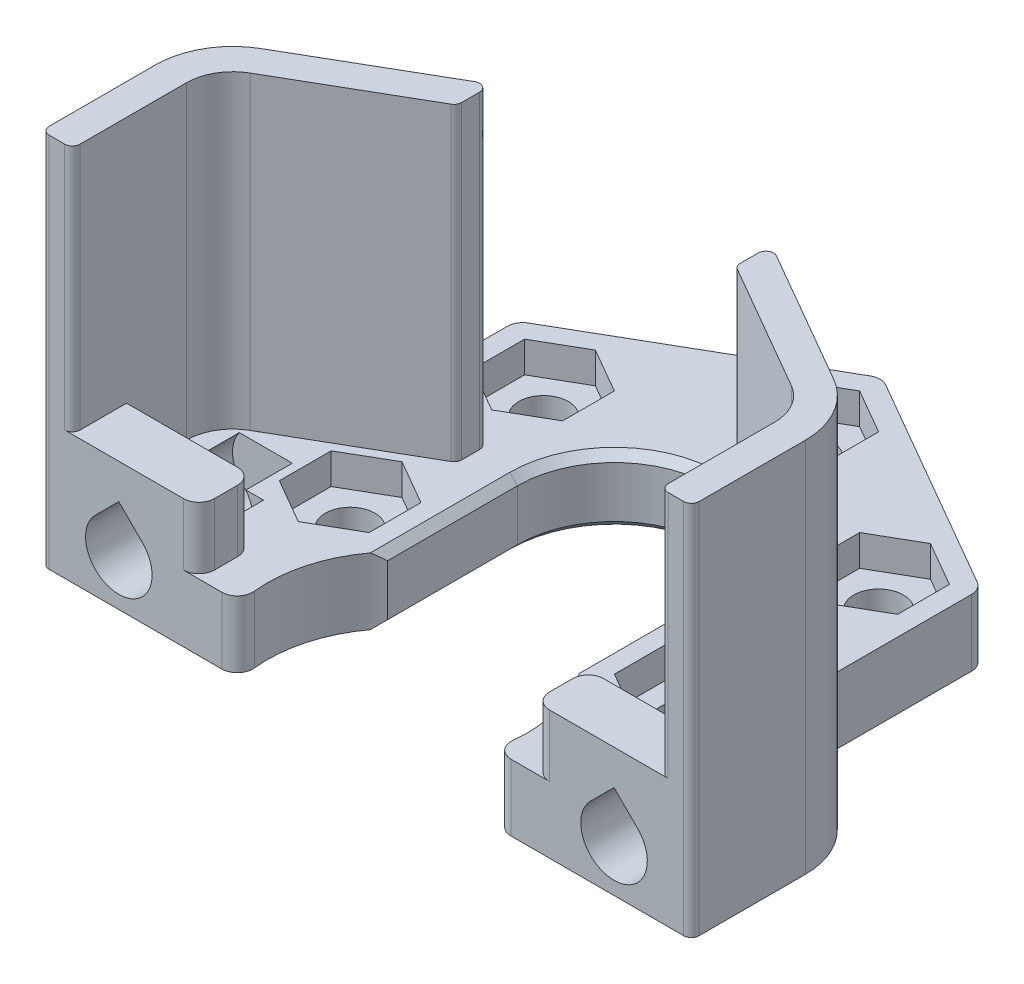
from build123d import *

# Parameters (mm, degrees)
SKETCH1_R                       = 1.6
BOSS_EXTRUDE1_DEPTH             = 4.3
FILLET1_R                       = 1
CUT_EXTRUDE1_DEPTH              = 2
BOSS_EXTRUDE2_DEPTH             = 4.3
SKETCH4_R                       = 8.4
CUT_EXTRUDE2_DEPTH              = 32.552755501
SKETCH5_W                       = 40
SKETCH5_H                       = 8
CUT_EXTRUDE3_DEPTH              = 32.552755501
MOVE_FACE1_DEPTH                = 4.3
BOSS_EXTRUDE3_START             = 4
BOSS_EXTRUDE3_DEPTH             = 4
SKETCH7_R                       = 2.15
CUT_EXTRUDE4_DEPTH              = 3.5
CUT_EXTRUDE5_DEPTH              = 3
SKETCH9_W                       = 21.650635094
SKETCH9_H                       = 3.5
CUT_EXTRUDE6_DEPTH              = 4
FILLET2_R                       = 1
CHAMFER1_SIZE                   = 0.5
CUT_EXTRUDE7_DEPTH              = 3.5
BOSS_EXTRUDE4_REACH             = 28.705
BOSS_EXTRUDE4_DIRECTION_2_DEPTH = 20
FILLET3_R                       = 3
FILLET4_R                       = 5
FILLET5_R                       = 0.5
CUT_EXTRUDE8_DEPTH              = 9.5


# Read off the part's stored shape, not the designer's step: Move Face1
with BuildPart() as part:
    # Sketch1 → Boss-Extrude1 (new body)
    with BuildSketch(Plane(origin=(0, 0, 0), x_dir=(1, 0, 0), z_dir=(0, 1, 0))):
        with BuildLine():
            Line((0, 17.320508076), (-15, 8.660254038))
            Line((-15, 8.660254038), (-15, -8.660254038))
            Line((-15, -8.660254038), (-6.25, -13.712068893))
            Line((-6.25, -13.712068893), (-6.25, 0))
            ThreePointArc((-6.25, 0), (0, 6.25), (6.25, 0))
            Line((6.25, 0), (6.25, -13.712068893))
            Line((6.25, -13.712068893), (15, -8.660254038))
            Line((15, -8.660254038), (15, 8.660254038))
            Line((15, 8.660254038), (0, 17.320508076))
        make_face()
        with Locations(Location((0, 12.5, 0), (0, 0, 90))):
            Circle(SKETCH1_R, mode=Mode.SUBTRACT)
        with Locations(Location((10.825317547, 6.25, 0), (0, 0, 90))):
            Circle(SKETCH1_R, mode=Mode.SUBTRACT)
        with Locations(Location((10.825317547, -6.25, 0), (0, 0, 90))):
            Circle(SKETCH1_R, mode=Mode.SUBTRACT)
        with Locations(Location((-10.825317547, -6.25, 0), (0, 0, 90))):
            Circle(SKETCH1_R, mode=Mode.SUBTRACT)
        with Locations(Location((-10.825317547, 6.25, 0), (0, 0, 90))):
            Circle(SKETCH1_R, mode=Mode.SUBTRACT)
    extrude(amount=BOSS_EXTRUDE1_DEPTH)

    # Fillet1
    fillet1_edges = [part.edges().sort_by_distance(p)[0] for p in [
        (15, 2.15, -8.660254038),
        (15, 2.15, 8.660254038),
        (6.25, 2.15, 13.712068893),
        (-6.25, 2.15, 13.712068893),
        (-15, 2.15, 8.660254038),
        (-15, 2.15, -8.660254038),
        (0, 2.15, -17.320508076),
    ]]
    fillet(fillet1_edges, radius=FILLET1_R)

    # Sketch2 → Cut-Extrude1 (cut)
    with BuildSketch(Plane(origin=(0, 4.3, 0), x_dir=(1, 0, 0), z_dir=(0, 1, 0))):
        Polygon((0, 15.848631561), (-2.9, 14.174315781), (-2.9, 10.825684219), (0, 9.151368439), (2.9, 10.825684219), (2.9, 14.174315781), align=None)
        Polygon((13.725317547, 4.575684219), (13.725317547, 7.924315781), (10.825317547, 9.598631561), (7.925317547, 7.924315781), (7.925317547, 4.575684219), (10.825317547, 2.901368439), align=None)
        Polygon((13.725317547, -4.575684219), (10.825317547, -2.901368439), (7.925317547, -4.575684219), (7.925317547, -7.924315781), (10.825317547, -9.598631561), (13.725317547, -7.924315781), align=None)
        Polygon((-13.725317547, -4.575684219), (-13.725317547, -7.924315781), (-10.825317547, -9.598631561), (-7.925317547, -7.924315781), (-7.925317547, -4.575684219), (-10.825317547, -2.901368439), align=None)
        Polygon((-13.725317547, 7.924315781), (-13.725317547, 4.575684219), (-10.825317547, 2.901368439), (-7.925317547, 4.575684219), (-7.925317547, 7.924315781), (-10.825317547, 9.598631561), align=None)
    extrude(amount=-CUT_EXTRUDE1_DEPTH, mode=Mode.SUBTRACT)

    # Sketch3 → Boss-Extrude2 (add)
    with BuildSketch(Plane(origin=(0, 4.3, 0), x_dir=(1, 0, 0), z_dir=(0, 1, 0))):
        with BuildLine():
            Line((-15, -8.082903769), (-6.25, -11.980018086))
            Line((-6.25, -11.980018086), (6.25, -11.980018086))
            Line((6.25, -11.980018086), (15, -8.082903769))
            Line((15, -8.082903769), (20, -10.969655115))
            Line((20, -10.969655115), (20, -22.376680266))
            ThreePointArc((20, -22.376680266), (19.517914755, -23.540537003), (18.354058018, -24.022622248))
            Line((18.354058018, -24.022622248), (-18.354058018, -24.022622248))
            ThreePointArc((-18.354058018, -24.022622248), (-19.517914755, -23.540537003), (-20, -22.376680266))
            Line((-20, -22.376680266), (-20, -10.969655115))
            Line((-20, -10.969655115), (-15, -8.082903769))
        make_face()
    extrude(amount=-BOSS_EXTRUDE2_DEPTH)

    # Sketch4 → Cut-Extrude2 (cut, through all)
    with BuildSketch(Plane(origin=(0, 4.3, 0), x_dir=(1, 0, 0), z_dir=(0, 1, 0))):
        with Locations((0, -14.022622248)):
            Circle(SKETCH4_R)
    extrude(amount=-CUT_EXTRUDE2_DEPTH, mode=Mode.SUBTRACT)

    # Sketch5 → Cut-Extrude3 (cut, through all)
    with BuildSketch(Plane(origin=(0, 4.3, 0), x_dir=(1, 0, 0), z_dir=(0, 1, 0))):
        with Locations((0, -20.022622248)):
            Rectangle(SKETCH5_W, SKETCH5_H)
    extrude(amount=-CUT_EXTRUDE3_DEPTH, mode=Mode.SUBTRACT)

    # Move Face1 outline → Move Face1 (add)
    with BuildSketch(Plane(origin=(0, 0, 0), x_dir=(1, 0, 0), z_dir=(0, 1, 0))):
        Polygon((20, -10.969655115), (20, -5.196152423), (15, -2.309401077), (15, -8.082903769), align=None)
        Polygon((-15, -2.309401077), (-20, -5.196152423), (-20, -10.969655115), (-15, -8.082903769), align=None)
    extrude(amount=MOVE_FACE1_DEPTH)

    # Sketch6 → Boss-Extrude3 (add)
    with BuildSketch(Plane(origin=(0, 4.3, 0), x_dir=(1, 0, 0), z_dir=(0, 1, 0)).offset(BOSS_EXTRUDE3_START)):
        with BuildLine():
            Line((-20, -12.522622248), (-8.264986388, -12.522622248))
            ThreePointArc((-8.264986388, -12.522622248), (-8.396109903, -14.278236217), (-8.158431222, -16.022622248))
            Line((-8.158431222, -16.022622248), (-20, -16.022622248))
            Line((-20, -16.022622248), (-20, -12.522622248))
        make_face()
        with BuildLine():
            Line((8.264986388, -12.522622248), (20, -12.522622248))
            Line((20, -12.522622248), (20, -16.022622248))
            Line((20, -16.022622248), (8.158431222, -16.022622248))
            ThreePointArc((8.158431222, -16.022622248), (8.396109903, -14.278236217), (8.264986388, -12.522622248))
        make_face()
    extrude(amount=-BOSS_EXTRUDE3_DEPTH)

    # Sketch7 → Cut-Extrude4 (cut)
    with BuildSketch(Plane.XY.offset(16.022622248)):
        with Locations((-16, 3)):
            Circle(SKETCH7_R)
        with Locations((16, 3)):
            Circle(SKETCH7_R)
    extrude(amount=-CUT_EXTRUDE4_DEPTH, mode=Mode.SUBTRACT)

    # Sketch8 → Cut-Extrude5 (cut)
    with BuildSketch(Plane(origin=(0, 0, 12.522622248), x_dir=(-1, 0, 0), z_dir=(0, 0, -1))):
        Polygon((16, 6.290896534), (13.15, 4.645448267), (13.15, 1.354551733), (16, -0.290896534), (18.85, 1.354551733), (18.85, 4.645448267), align=None)
        Polygon((-18.85, 4.645448267), (-16, 6.290896534), (-13.15, 4.645448267), (-13.15, 1.354551733), (-16, -0.290896534), (-18.85, 1.354551733), align=None)
    extrude(amount=CUT_EXTRUDE5_DEPTH, mode=Mode.SUBTRACT)

    # Sketch9 → Cut-Extrude6 (cut)
    with BuildSketch(Plane(origin=(0, 4.3, 0), x_dir=(1, 0, 0), z_dir=(0, 1, 0))):
        with Locations((0, -14.272622248)):
            Rectangle(SKETCH9_W, SKETCH9_H)
    extrude(amount=CUT_EXTRUDE6_DEPTH, mode=Mode.SUBTRACT)

    # Fillet2
    fillet2_edges = [part.edges().sort_by_distance(p)[0] for p in [
        (20, 2.15, 5.196152423),
        (-20, 2.15, 5.196152423),
        (8.158431222, 2.15, 16.022622248),
        (20, 6.3, 12.522622248),
        (-20, 6.3, 12.522622248),
        (-8.158431222, 2.15, 16.022622248),
        (-10.825317547, 6.3, 16.022622248),
        (10.825317547, 6.3, 12.522622248),
        (-10.825317547, 6.3, 12.522622248),
        (10.825317547, 6.3, 16.022622248),
        (15, 2.15, 2.309401077),
        (-15, 2.15, 2.309401077),
    ]]
    fillet(fillet2_edges, radius=FILLET2_R)

    # Chamfer1
    chamfer1_edges = [part.edges().sort_by_distance(p)[0] for p in [
        (0, 4.3, -6.25),
        (6.25, 4.3, 4.205179445),
        (-6.25, 4.3, 4.205179445),
        (-6.25, 0, 4.205179445),
        (6.25, 0, 4.205179445),
        (0, 0, -6.25),
    ]]
    chamfer(chamfer1_edges, length=CHAMFER1_SIZE)

    # Sketch10 → Cut-Extrude7 (cut)
    with BuildSketch(Plane.XY.offset(16.022622248)):
        with BuildLine():
            Line((-17.52027958, 4.52027958), (-16, 6.040559159))
            Line((-16, 6.040559159), (-14.47972042, 4.52027958))
            ThreePointArc((-14.47972042, 4.52027958), (-16, 0.85), (-17.52027958, 4.52027958))
        make_face()
        with BuildLine():
            Line((14.47972042, 4.52027958), (16, 6.040559159))
            Line((16, 6.040559159), (17.52027958, 4.52027958))
            ThreePointArc((17.52027958, 4.52027958), (16, 0.85), (14.47972042, 4.52027958))
        make_face()
    extrude(amount=-CUT_EXTRUDE7_DEPTH, mode=Mode.SUBTRACT)

    # Boss-Extrude4: up to this face of the body (flat: up to its plane)
    boss_extrude4_end = Plane(part.part.faces().sort_by_distance((-8.607291251, 0, 11.682408659))[0])
    # Sketch11 → Boss-Extrude4 (add, up to the picked face)
    with BuildSketch(Plane(origin=(0, 4.3, 0), x_dir=(1, 0, 0), z_dir=(0, 1, 0)), mode=Mode.PRIVATE) as boss_extrude4_sk1:
        Polygon((9, -1.154700538), (19, -6.92820323), (19, -16.022622248), (21, -16.022622248), (21, -5.773502692), (9, 1.154700538), align=None)
    boss_extrude4_tool1 = split(extrude(boss_extrude4_sk1.sketch, amount=-BOSS_EXTRUDE4_REACH, mode=Mode.PRIVATE), bisect_by=boss_extrude4_end, keep=Keep.BOTH, mode=Mode.PRIVATE)
    # Sketch11 → Boss-Extrude4 (add, up to the picked face)
    with BuildSketch(Plane(origin=(0, 4.3, 0), x_dir=(1, 0, 0), z_dir=(0, 1, 0)), mode=Mode.PRIVATE) as boss_extrude4_sk2:
        Polygon((-9, 1.154700538), (-9, -1.154700538), (-19, -6.92820323), (-19, -16.022622248), (-21, -16.022622248), (-21, -5.773502692), align=None)
    boss_extrude4_tool2 = split(extrude(boss_extrude4_sk2.sketch, amount=-BOSS_EXTRUDE4_REACH, mode=Mode.PRIVATE), bisect_by=boss_extrude4_end, keep=Keep.BOTH, mode=Mode.PRIVATE)
    add(boss_extrude4_tool1.solids().sort_by(Axis((14.104769, 4.3, 3.859987), (0, -1, 0)))[0])
    add(boss_extrude4_tool2.solids().sort_by(Axis((-9.209538, 4.3, 0), (0, -1, 0)))[0])

    # Sketch11 → Boss-Extrude4 direction 2 (add)
    with BuildSketch(Plane(origin=(0, 4.3, 0), x_dir=(1, 0, 0), z_dir=(0, 1, 0))):
        Polygon((9, -1.154700538), (19, -6.92820323), (19, -16.022622248), (21, -16.022622248), (21, -5.773502692), (9, 1.154700538), align=None)
        Polygon((-9, 1.154700538), (-9, -1.154700538), (-19, -6.92820323), (-19, -16.022622248), (-21, -16.022622248), (-21, -5.773502692), align=None)
    extrude(amount=BOSS_EXTRUDE4_DIRECTION_2_DEPTH)

    # Fillet3
    fillet3_edges = [part.edges().sort_by_distance(p)[0] for p in [
        (19, 14.3, 6.92820323),
        (-19, 14.3, 6.92820323),
    ]]
    fillet(fillet3_edges, radius=FILLET3_R)

    # Fillet4
    fillet4_edges = [part.edges().sort_by_distance(p)[0] for p in [
        (21, 12.15, 5.773502692),
        (-21, 12.15, 5.773502692),
    ]]
    fillet(fillet4_edges, radius=FILLET4_R)

    # Fillet5
    fillet5_edges = [part.edges().sort_by_distance(p)[0] for p in [
        (9, 14.3, -1.154700538),
        (9, 14.3, 1.154700538),
        (19, 16.3, 16.022622248),
        (21, 12.15, 16.022622248),
        (-9, 14.3, -1.154700538),
        (-21, 12.15, 16.022622248),
        (-19, 16.3, 16.022622248),
        (-9, 14.3, 1.154700538),
    ]]
    fillet(fillet5_edges, radius=FILLET5_R)

    # Sketch12 → Cut-Extrude8 (cut)
    with BuildSketch(Plane.XY.offset(16.022622248)):
        with BuildLine():
            Line((-16, 6.040559159), (-17.52027958, 4.52027958))
            ThreePointArc((-17.52027958, 4.52027958), (-16, 0.85), (-14.47972042, 4.52027958))
            Line((-14.47972042, 4.52027958), (-16, 6.040559159))
        make_face()
        with BuildLine():
            Line((16, 6.040559159), (14.47972042, 4.52027958))
            ThreePointArc((14.47972042, 4.52027958), (16, 0.85), (17.52027958, 4.52027958))
            Line((17.52027958, 4.52027958), (16, 6.040559159))
        make_face()
    extrude(amount=-CUT_EXTRUDE8_DEPTH, mode=Mode.SUBTRACT)


solid = part.part
